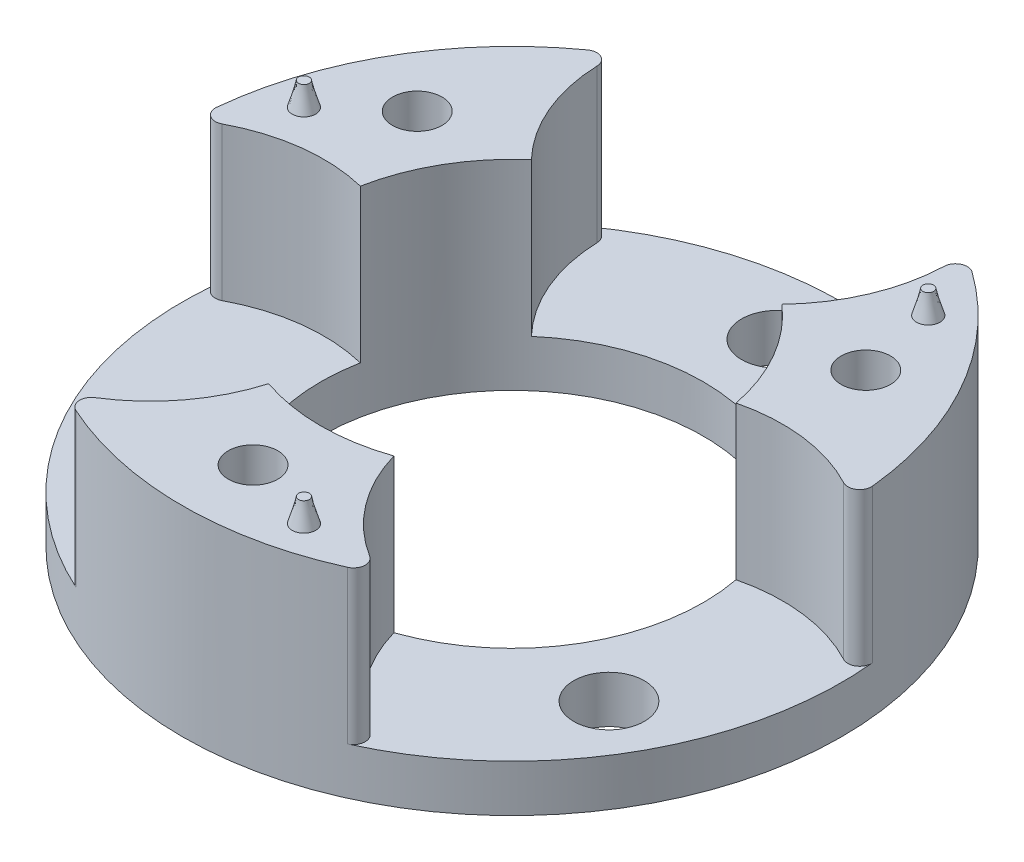
from build123d import *
from build123d.topology import SkipClean

# Parameters (mm, degrees)
ESBO_O1_R                = 28
RESSALTO_EXTRUS_O1_DEPTH = 4
ESBO_O2_R                = 3
CORTE_EXTRUS_O1_DEPTH    = 40.799497484
PADR_OCIRCULAR1_COUNT    = 3
ESBO_O3_R                = 16.25
CORTE_EXTRUS_O2_DEPTH    = 40.799497484
RESSALTO_EXTRUS_O2_DEPTH = 13
PADR_OCIRCULAR2_COUNT    = 3
ESBO_O5_R                = 2.1
CORTE_EXTRUS_O3_DEPTH    = 8
PADR_OCIRCULAR3_COUNT    = 3
PADR_OCIRCULAR4_COUNT    = 3


with BuildPart() as part:
    # Esboço1 → Ressalto-extrusão1 (new body)
    with BuildSketch(Plane(origin=(0, 0, 0), x_dir=(1, 0, 0), z_dir=(0, 1, 0))):
        with Locations(Location((0, 0, 0), (0, 0, 270))):
            Circle(ESBO_O1_R)
    extrude(amount=RESSALTO_EXTRUS_O1_DEPTH)

    # Esboço2 → Corte-extrusão1 (cut, through all)
    with BuildSketch(Plane(origin=(0, 4, 0), x_dir=(1, 0, 0), z_dir=(0, 1, 0))):
        with Locations(Location((0, 22.5, 0), (0, 0, 270))):
            Circle(ESBO_O2_R)
    corte_extrus_o1 = extrude(amount=-CORTE_EXTRUS_O1_DEPTH, mode=Mode.SUBTRACT)

    # PadrãoCircular1: Corte-extrusão1 ×3 about axis
    padr_ocircular1_axis = Axis((0, 0, 0), (0, 1, 0))
    for i in range(1, PADR_OCIRCULAR1_COUNT):
        add(corte_extrus_o1.rotate(padr_ocircular1_axis, i * 360 / PADR_OCIRCULAR1_COUNT), mode=Mode.SUBTRACT)

    # Esboço3 → Corte-extrusão2 (cut, through all)
    with BuildSketch(Plane(origin=(0, 4, 0), x_dir=(1, 0, 0), z_dir=(0, 1, 0))):
        with Locations(Location((0, 0, 0), (0, 0, 270))):
            Circle(ESBO_O3_R)
    extrude(amount=-CORTE_EXTRUS_O2_DEPTH, mode=Mode.SUBTRACT)

    # Esboço4 → Ressalto-extrusão2 (add)
    with SkipClean():  # the faces are left unmerged after this step: merging them gives an invalid solid
        with BuildSketch(Plane(origin=(0, 4, 0), x_dir=(1, 0, 0), z_dir=(0, 1, 0))):
            with BuildLine():
                ThreePointArc((10.638713373, 12.283333333), (13.583103826, 16.7500617), (14.740590111, 21.973214286))
                ThreePointArc((14.740590111, 21.973214286), (15.299274914, 22.835165623), (16.322913343, 22.75))
                ThreePointArc((16.322913343, 22.75), (24.248711306, 14), (27.863534608, 2.761057619))
                ThreePointArc((27.863534608, 2.761057619), (27.425470986, 1.831977923), (26.39965683, 1.77911836))
                ThreePointArc((26.39965683, 1.77911836), (21.29753086, 3.388282126), (15.957035396, 3.071729378))
                ThreePointArc((15.957035396, 3.071729378), (14.072912811, 8.125), (10.638713373, 12.283333333))
            make_face()
        ressalto_extrus_o2 = extrude(amount=RESSALTO_EXTRUS_O2_DEPTH)

    # PadrãoCircular2: Ressalto-extrusão2 ×3 about axis
    with SkipClean():  # the faces are left unmerged after this step: merging them gives an invalid solid
        padr_ocircular2_axis = Axis((0, 0, 0), (0, 1, 0))
        for i in range(1, PADR_OCIRCULAR2_COUNT):
            add(ressalto_extrus_o2.rotate(padr_ocircular2_axis, i * 360 / PADR_OCIRCULAR2_COUNT))

    # Esboço5 → Corte-extrusão3 (cut)
    with SkipClean():  # the faces are left unmerged after this step: merging them gives an invalid solid
        with BuildSketch(Plane(origin=(0, 17, 0), x_dir=(1, 0, 0), z_dir=(0, 1, 0))):
            with Locations(Location((0, -22, 0), (0, 0, 270))):
                Circle(ESBO_O5_R)
        corte_extrus_o3 = extrude(amount=-CORTE_EXTRUS_O3_DEPTH, mode=Mode.SUBTRACT)

    # PadrãoCircular3: Corte-extrusão3 ×3 about axis
    with SkipClean():  # the faces are left unmerged after this step: merging them gives an invalid solid
        padr_ocircular3_axis = Axis((0, 0, 0), (0, 1, 0))
        for i in range(1, PADR_OCIRCULAR3_COUNT):
            add(corte_extrus_o3.rotate(padr_ocircular3_axis, i * 360 / PADR_OCIRCULAR3_COUNT), mode=Mode.SUBTRACT)

    # Loft1: read off the stored shape, not the designer's step
    # Loft1: loft between two sections, ruled curve by curve
    with SkipClean():  # the faces are left unmerged after this step: merging them gives an invalid solid
        loft1_from = [
            Edge.make_bspline([(7.471626812, 17, 24.108508402), (7.389968108, 17, 22.110176134), (5.391635839, 17, 22.191834838), (5.473294543, 17, 24.190167106), (5.554953247, 17, 26.188499375), (7.553285516, 17, 26.106840671), (7.471626812, 17, 24.108508402)], [0, 0, 0, 0, 0.5, 0.5, 0.5, 1, 1, 1, 1], 3, [1, 0.333333333, 0.333333333, 1, 0.333333333, 0.333333333, 1]),
        ]
        loft1_to = [
            Edge.make_bspline([(6.858825303, 19, 24.398982253), (7.358114301, 19, 23.626253002), (6.58538505, 19, 23.126964004), (6.086096051, 19, 23.899693255), (5.586807053, 19, 24.672422507), (6.359536305, 19, 25.171711505), (6.858825303, 19, 24.398982253)], [0, 0, 0, 0, 0.5, 0.5, 0.5, 1, 1, 1, 1], 3, [1, 0.333333333, 0.333333333, 1, 0.333333333, 0.333333333, 1]),
        ]
        loft1 = Solid(Shell([*[Face.make_surface_from_curves(loft1_from[k], loft1_to[k]) for k in range(1)], Face(Wire(loft1_from)), Face(Wire(loft1_to))]))
        add(loft1)

    # PadrãoCircular4: Loft1 ×3 about axis
    with SkipClean():  # the faces are left unmerged after this step: merging them gives an invalid solid
        padr_ocircular4_axis = Axis((0, 0, 0), (0, -1, 0))
        for i in range(1, PADR_OCIRCULAR4_COUNT):
            add(loft1.rotate(padr_ocircular4_axis, i * 360 / PADR_OCIRCULAR4_COUNT))


solid = part.part
